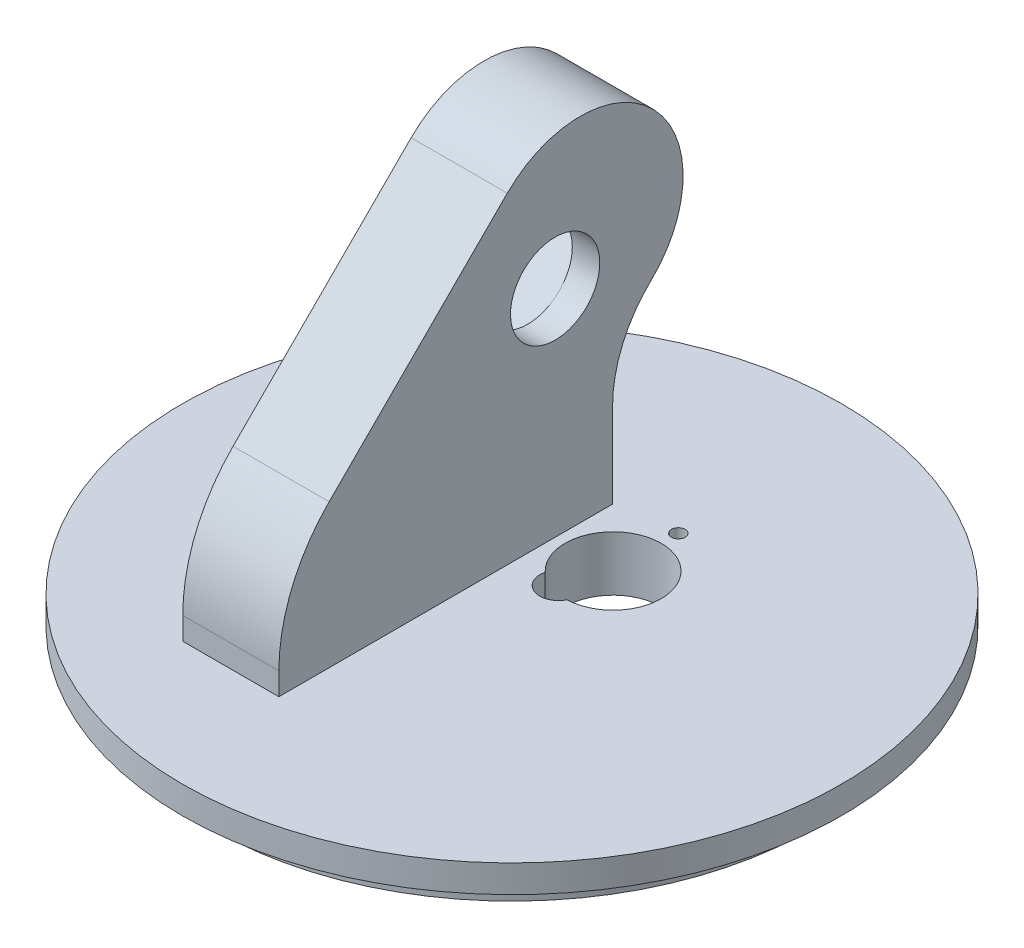
from build123d import *

# Parameters (mm, degrees)
SKETCH2_R           = 48
BOSS_EXTRUDE1_DEPTH = 4
BOSS_EXTRUDE2_DEPTH = 14
SKETCH31_R          = 6.5
CUT_EXTRUDE18_DEPTH = 96.977067922
CUT_EXTRUDE19_DEPTH = 10
SKETCH32_R          = 1
CUT_EXTRUDE20_DEPTH = 4.5
SKETCH33_R          = 43.5
BOSS_EXTRUDE3_DEPTH = 4
SKETCH35_R          = 7
CUT_EXTRUDE22_DEPTH = 93.968532394
SKETCH36_R          = 2.701818283
CUT_EXTRUDE24_DEPTH = 86.072189458
SKETCH37_R          = 1
CUT_EXTRUDE25_DEPTH = 4.5


with BuildPart() as part:
    # Sketch2 → Boss-Extrude1 (new body)
    with BuildSketch(Plane(origin=(0, 0, 0), x_dir=(1, 0, 0), z_dir=(0, 1, 0))):
        Circle(SKETCH2_R)
    extrude(amount=BOSS_EXTRUDE1_DEPTH)

    # Sketch7 → Boss-Extrude2 (add)
    with BuildSketch(Plane(origin=(-4, 0, 0), x_dir=(0, 0, -1), z_dir=(1, 0, 0))):
        with BuildLine():
            Line((18.652115716, 4), (18.652115716, 16.356133126))
            ThreePointArc((18.652115716, 16.356133126), (20.111216245, 23.455333411), (24.251965127, 29.403595153))
            ThreePointArc((24.251965127, 29.403595153), (24.659117989, 50.747356958), (3.311904584, 50.883081894))
            Line((3.311904584, 50.883081894), (-22.631121669, 24.94005564))
            ThreePointArc((-22.631121669, 24.94005564), (-28.050440452, 16.82947192), (-29.95345214, 7.262386111))
            Line((-29.95345214, 7.262386111), (-29.95345214, 4))
            Line((-29.95345214, 4), (18.652115716, 4))
        make_face()
    extrude(amount=-BOSS_EXTRUDE2_DEPTH)

    # Sketch31 → Cut-Extrude18 (cut, through all)
    with BuildSketch(Plane(origin=(-18, 10.461755651, -5.359516796), x_dir=(0, 0, 1), z_dir=(-1, 0, 0))):
        with Locations((-4.922469695, 24.905412087)):
            Circle(SKETCH31_R)
    extrude(amount=-CUT_EXTRUDE18_DEPTH, mode=Mode.SUBTRACT)

    # Sketch31<3> → Cut-Extrude19 (cut)
    with BuildSketch(Plane(origin=(-18, 10.461755651, -5.359516796), x_dir=(0, 0, 1), z_dir=(-1, 0, 0))):
        Polygon((-5.41546104, 34.054639751), (11.74960782, 18.74580534), (3.09678837, 9.043809897), (-14.06828049, 24.352644308), align=None)
    extrude(amount=-CUT_EXTRUDE19_DEPTH, mode=Mode.SUBTRACT)

    # Sketch32 → Cut-Extrude20 (cut)
    with BuildSketch(Plane.ZY.offset(18)):
        with Locations((-17.080620038, 41.264504586)):
            Circle(SKETCH32_R)
        with Locations((3.929449654, 22.692559529)):
            Circle(SKETCH32_R)
    extrude(amount=-CUT_EXTRUDE20_DEPTH, mode=Mode.SUBTRACT)

    # Sketch33 → Boss-Extrude3 (add)
    with BuildSketch(Plane.XZ):
        Circle(SKETCH33_R)
    extrude(amount=BOSS_EXTRUDE3_DEPTH)

    # Sketch35 → Cut-Extrude22 (cut, through all)
    with BuildSketch(Plane(origin=(-3.192833023, 4, -10.250875044), x_dir=(1, 0, 0), z_dir=(0, 1, 0))):
        with Locations((7.665516898, 0)):
            Circle(SKETCH35_R)
    extrude(amount=-CUT_EXTRUDE22_DEPTH, mode=Mode.SUBTRACT)

    # Sketch36 → Cut-Extrude24 (cut, through all)
    with BuildSketch(Plane(origin=(0, 4, 0), x_dir=(1, 0, 0), z_dir=(0, 1, 0))):
        with Locations((2.310071728, 4.444115209)):
            Circle(SKETCH36_R)
    extrude(amount=-CUT_EXTRUDE24_DEPTH, mode=Mode.SUBTRACT)

    # Sketch37 → Cut-Extrude25 (cut)
    with BuildSketch(Plane(origin=(0, 4, 0), x_dir=(1, 0, 0), z_dir=(0, 1, 0))):
        with Locations((4.472683875, 19.750875044)):
            Circle(SKETCH37_R)
    extrude(amount=-CUT_EXTRUDE25_DEPTH, mode=Mode.SUBTRACT)


solid = part.part
